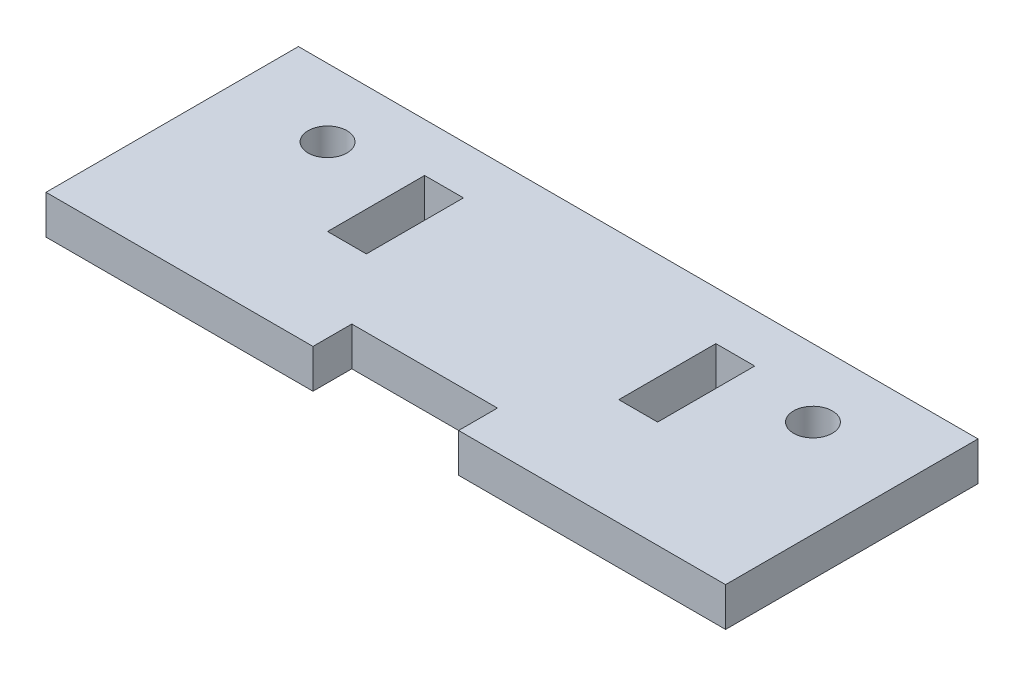
from build123d import *

# Parameters (mm, degrees)
SKETCH1_R           = 2
SKETCH1_W           = 4
SKETCH1_H           = 10
BOSS_EXTRUDE1_DEPTH = 4


with BuildPart() as part:
    # Sketch1 → Boss-Extrude1 (new body)
    with BuildSketch(Plane(origin=(0, 0, 0), x_dir=(1, 0, 0), z_dir=(0, 1, 0))):
        Polygon((0, 0), (20, 0), (27.5, 0), (27.5, 4), (42.5, 4), (42.5, 0), (50, 0), (70, 0), (70, 26), (0, 26), align=None)
        with Locations((10, 19)):
            Circle(SKETCH1_R, mode=Mode.SUBTRACT)
        with Locations((60, 19)):
            Circle(SKETCH1_R, mode=Mode.SUBTRACT)
        with Locations((20, 16)):
            Rectangle(SKETCH1_W, SKETCH1_H, mode=Mode.SUBTRACT)
        with Locations((50, 16)):
            Rectangle(SKETCH1_W, SKETCH1_H, mode=Mode.SUBTRACT)
    extrude(amount=BOSS_EXTRUDE1_DEPTH)


solid = part.part
